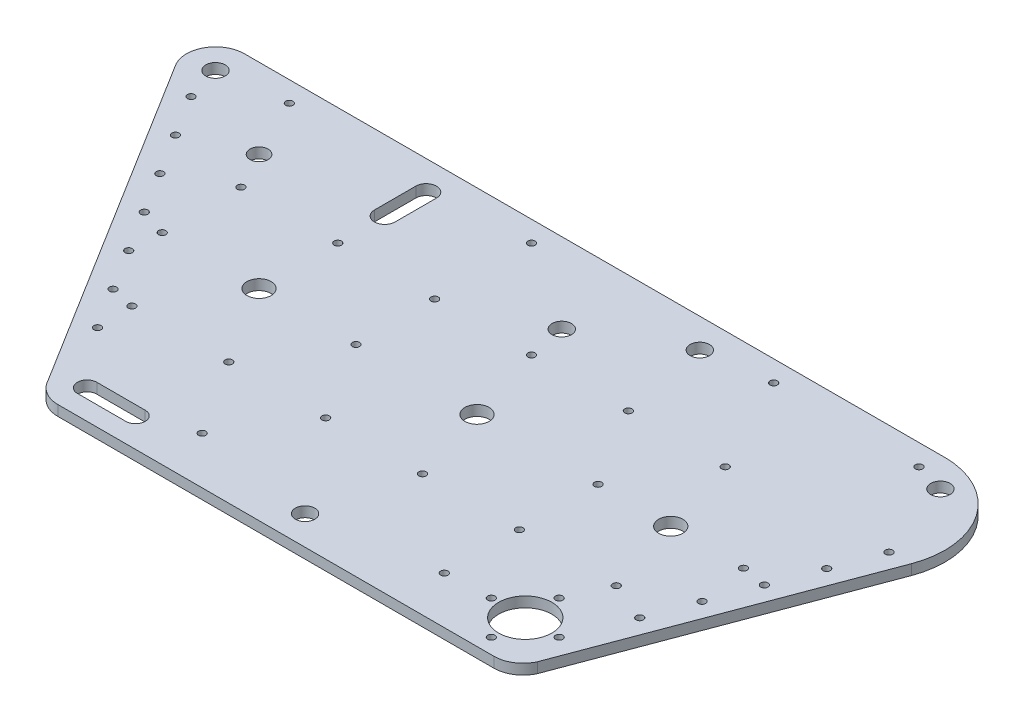
from build123d import *

# Parameters (mm, degrees)
BOSS_EXTRUDE1_DEPTH = 2


with BuildPart() as part:
    # Sketch1 → Boss-Extrude1 (new body)
    with BuildSketch(Plane(origin=(0, 0, 0), x_dir=(1, 0, 0), z_dir=(0, 1, 0))):
        with BuildLine():
            Line((85.656701038, 67.976827221), (-49.628186638, 67.857885829))
            add(Edge.make_bspline(
                [(-49.628186638, 67.857885829), (-59.775166253, 67.848964685), (-54.347438121, 59.275261117)],
                knots=[0.000879148, 0.000879148, 0.000879148, 2.135198153, 2.135198153, 2.135198153], degree=2, weights=[1, 0.482613975, 1]))
            Line((-54.347438121, 59.275261117), (-13.905478058, -5.817250798))
            add(Edge.make_bspline(
                [(-13.905478058, -5.817250798), (-12.345348453, -8.895182027), (-8.894737247, -8.895182019)],
                knots=[2.039949792, 2.039949792, 2.039949792, 3.141592656, 3.141592656, 3.141592656], degree=2, weights=[1, 0.852094883, 1]))
            Line((-8.894737247, -8.895182019), (75.37119476, -8.895182019))
            add(Edge.make_bspline(
                [(75.37119476, -8.895182019), (78.976029181, -8.895181965), (80.478043524, -5.618009696)],
                knots=[3.141592668, 3.141592668, 3.141592668, 4.282613549, 4.282613549, 4.282613549], degree=2, weights=[1, 0.841625416, 1]))
            Line((80.478043524, -5.618009696), (100.220157787, 46.97229785))
            add(Edge.make_bspline(
                [(100.220157787, 46.97229785), (108.112194499, 67.995610365), (85.657365109, 67.97682779)],
                knots=[4.353256006, 4.353256006, 4.353256006, 6.284014289, 6.284014289, 6.284014289], degree=2, weights=[1, 0.569095733, 0.999977608]))
            Line((85.657365109, 67.976827804), (85.656701038, 67.976827221))
        make_face()
        with BuildLine():
            add(Edge.make_bspline(
                [(-17.959803405, 8.507196014), (-19.176077367, 8.507196014), (-18.567940386, 7.453819196), (-17.959803405, 6.400442378), (-17.351666423, 7.453819196), (-16.743529442, 8.507196014), (-17.959803405, 8.507196014)],
                knots=[0, 0, 0, 2.094395102, 2.094395102, 4.188790205, 4.188790205, 6.283185307, 6.283185307, 6.283185307], degree=2, weights=[1, 0.5, 1, 0.5, 1, 0.5, 1]))
        make_face(mode=Mode.SUBTRACT)
        with BuildLine():
            add(Edge.make_bspline(
                [(-8.89473726, -1.404502424), (-10.767313525, -1.404502424), (-10.767313525, -3.277172323), (-10.767313525, -5.149842222), (-8.89473726, -5.149842222)],
                knots=[3.141592654, 3.141592654, 3.141592654, 4.71238898, 4.71238898, 6.283185307, 6.283185307, 6.283185307], degree=2, weights=[1, 0.707106781, 1, 0.707106781, 1]))
            Line((-8.89473726, -1.404502424), (0.468144066, -1.404502424))
            add(Edge.make_bspline(
                [(0.468144066, -5.149842222), (2.340720332, -5.149842222), (2.340720332, -3.277172323), (2.340720332, -1.404502424), (0.468144066, -1.404502424)],
                knots=[0, 0, 0, 1.570796327, 1.570796327, 3.141592654, 3.141592654, 3.141592654], degree=2, weights=[1, 0.707106781, 1, 0.707106781, 1]))
            Line((0.468144066, -5.149842222), (-8.89473726, -5.149842222))
        make_face(mode=Mode.SUBTRACT)
        with BuildLine():
            add(Edge.make_bspline(
                [(9.831025393, 0.936334949), (8.61475143, 0.936334949), (9.222888411, -0.117041869), (9.831025393, -1.170418687), (10.439162374, -0.117041869), (11.047299355, 0.936334949), (9.831025393, 0.936334949)],
                knots=[0, 0, 0, 2.094395102, 2.094395102, 4.188790205, 4.188790205, 6.283185307, 6.283185307, 6.283185307], degree=2, weights=[1, 0.5, 1, 0.5, 1, 0.5, 1]))
        make_face(mode=Mode.SUBTRACT)
        with BuildLine():
            add(Edge.make_bspline(
                [(-18.257618586, 14.045021577), (-17.041344624, 14.045021577), (-17.649481605, 15.098398395), (-18.257618586, 16.151775213), (-18.865755567, 15.098398395), (-19.473892548, 14.045021577), (-18.257618586, 14.045021577)],
                knots=[0, 0, 0, 2.094395102, 2.094395102, 4.188790205, 4.188790205, 6.283185307, 6.283185307, 6.283185307], degree=2, weights=[1, 0.5, 1, 0.5, 1, 0.5, 1]))
        make_face(mode=Mode.SUBTRACT)
        with BuildLine():
            add(Edge.make_bspline(
                [(-22.90100282, 15.055697878), (-21.684728858, 15.055697878), (-22.292865839, 16.109074696), (-22.90100282, 17.162451514), (-23.509139801, 16.109074696), (-24.117276782, 15.055697878), (-22.90100282, 15.055697878)],
                knots=[0, 0, 0, 2.094395102, 2.094395102, 4.188790205, 4.188790205, 6.283185307, 6.283185307, 6.283185307], degree=2, weights=[1, 0.5, 1, 0.5, 1, 0.5, 1]))
        make_face(mode=Mode.SUBTRACT)
        with BuildLine():
            add(Edge.make_bspline(
                [(-27.842276924, 24.413324804), (-29.058550886, 24.413324804), (-28.450413905, 23.359947986), (-27.842276924, 22.306571168), (-27.234139943, 23.359947986), (-26.626002962, 24.413324804), (-27.842276924, 24.413324804)],
                knots=[0, 0, 0, 2.094395102, 2.094395102, 4.188790205, 4.188790205, 6.283185307, 6.283185307, 6.283185307], degree=2, weights=[1, 0.5, 1, 0.5, 1, 0.5, 1]))
        make_face(mode=Mode.SUBTRACT)
        with BuildLine():
            add(Edge.make_bspline(
                [(0.468144066, 15.449523113), (-0.748129896, 15.449523113), (-0.139992915, 14.396146295), (0.468144066, 13.342769477), (1.076281047, 14.396146295), (1.684418028, 15.449523113), (0.468144066, 15.449523113)],
                knots=[0, 0, 0, 2.094395102, 2.094395102, 4.188790205, 4.188790205, 6.283185307, 6.283185307, 6.283185307], degree=2, weights=[1, 0.5, 1, 0.5, 1, 0.5, 1]))
        make_face(mode=Mode.SUBTRACT)
        with BuildLine():
            add(Edge.make_bspline(
                [(19.193906719, 14.045018914), (20.410180681, 14.045018914), (19.8020437, 15.098395732), (19.193906719, 16.15177255), (18.585769738, 15.098395732), (17.977632757, 14.045018914), (19.193906719, 14.045018914)],
                knots=[0, 0, 0, 2.094395102, 2.094395102, 4.188790205, 4.188790205, 6.283185307, 6.283185307, 6.283185307], degree=2, weights=[1, 0.5, 1, 0.5, 1, 0.5, 1]))
        make_face(mode=Mode.SUBTRACT)
        with BuildLine():
            add(Edge.make_bspline(
                [(33.238228708, -1.404502424), (29.994831476, -1.404502424), (31.616530092, -4.213507272), (33.238228708, -7.02251212), (34.859927324, -4.213507272), (36.481625941, -1.404502424), (33.238228708, -1.404502424)],
                knots=[0, 0, 0, 2.094395102, 2.094395102, 4.188790205, 4.188790205, 6.283185307, 6.283185307, 6.283185307], degree=2, weights=[1, 0.5, 1, 0.5, 1, 0.5, 1]))
        make_face(mode=Mode.SUBTRACT)
        with BuildLine():
            add(Edge.make_bspline(
                [(56.645432024, 0.936334949), (55.429158062, 0.936334949), (56.037295043, -0.117041869), (56.645432024, -1.170418687), (57.253569005, -0.117041869), (57.861705986, 0.936334949), (56.645432024, 0.936334949)],
                knots=[0, 0, 0, 2.094395102, 2.094395102, 4.188790205, 4.188790205, 6.283185307, 6.283185307, 6.283185307], degree=2, weights=[1, 0.5, 1, 0.5, 1, 0.5, 1]))
        make_face(mode=Mode.SUBTRACT)
        with BuildLine():
            add(Edge.make_bspline(
                [(65.376638006, 1.295412091), (64.160364044, 1.295412091), (64.768501025, 0.242035273), (65.376638006, -0.811341545), (65.984774987, 0.242035273), (66.592911968, 1.295412091), (65.376638006, 1.295412091)],
                knots=[0, 0, 0, 2.094395102, 2.094395102, 4.188790205, 4.188790205, 6.283185307, 6.283185307, 6.283185307], degree=2, weights=[1, 0.5, 1, 0.5, 1, 0.5, 1]))
        make_face(mode=Mode.SUBTRACT)
        with BuildLine():
            add(Edge.make_bspline(
                [(71.930654934, -6.663434979), (73.146928897, -6.663434979), (72.538791915, -5.610058161), (71.930654934, -4.556681343), (71.322517953, -5.610058161), (70.714380972, -6.663434979), (71.930654934, -6.663434979)],
                knots=[0, 0, 0, 2.094395102, 2.094395102, 4.188790205, 4.188790205, 6.283185307, 6.283185307, 6.283185307], degree=2, weights=[1, 0.5, 1, 0.5, 1, 0.5, 1]))
        make_face(mode=Mode.SUBTRACT)
        with BuildLine():
            add(Edge.make_bspline(
                [(71.930654934, 5.7430031), (63.011312545, 5.7430031), (67.47098374, -1.981760232), (71.930654934, -9.706523564), (76.390326129, -1.981760232), (80.849997324, 5.7430031), (71.930654934, 5.7430031)],
                knots=[0, 0, 0, 2.094395102, 2.094395102, 4.188790205, 4.188790205, 6.283185307, 6.283185307, 6.283185307], degree=2, weights=[1, 0.5, 1, 0.5, 1, 0.5, 1]))
        make_face(mode=Mode.SUBTRACT)
        with BuildLine():
            add(Edge.make_bspline(
                [(78.484671863, 1.295412091), (77.268397901, 1.295412091), (77.876534882, 0.242035273), (78.484671863, -0.811341545), (79.092808844, 0.242035273), (79.700945825, 1.295412091), (78.484671863, 1.295412091)],
                knots=[0, 0, 0, 2.094395102, 2.094395102, 4.188790205, 4.188790205, 6.283185307, 6.283185307, 6.283185307], degree=2, weights=[1, 0.5, 1, 0.5, 1, 0.5, 1]))
        make_face(mode=Mode.SUBTRACT)
        with BuildLine():
            add(Edge.make_bspline(
                [(71.930654934, 7.849756737), (70.714380972, 7.849756737), (71.322517953, 6.796379918), (71.930654934, 5.7430031), (72.538791915, 6.796379918), (73.146928897, 7.849756737), (71.930654934, 7.849756737)],
                knots=[0, 0, 0, 2.094395102, 2.094395102, 4.188790205, 4.188790205, 6.283185307, 6.283185307, 6.283185307], degree=2, weights=[1, 0.5, 1, 0.5, 1, 0.5, 1]))
        make_face(mode=Mode.SUBTRACT)
        with BuildLine():
            add(Edge.make_bspline(
                [(37.919669371, 14.045017582), (39.135943333, 14.045017582), (38.527806352, 15.0983944), (37.919669371, 16.151771218), (37.31153239, 15.0983944), (36.703395409, 14.045017582), (37.919669371, 14.045017582)],
                knots=[0, 0, 0, 2.094395102, 2.094395102, 4.188790205, 4.188790205, 6.283185307, 6.283185307, 6.283185307], degree=2, weights=[1, 0.5, 1, 0.5, 1, 0.5, 1]))
        make_face(mode=Mode.SUBTRACT)
        with BuildLine():
            add(Edge.make_bspline(
                [(56.645432024, 15.449517787), (55.429158062, 15.449517787), (56.037295043, 14.396140969), (56.645432024, 13.342764151), (57.253569005, 14.396140969), (57.861705986, 15.449517787), (56.645432024, 15.449517787)],
                knots=[0, 0, 0, 2.094395102, 2.094395102, 4.188790205, 4.188790205, 6.283185307, 6.283185307, 6.283185307], degree=2, weights=[1, 0.5, 1, 0.5, 1, 0.5, 1]))
        make_face(mode=Mode.SUBTRACT)
        with BuildLine():
            add(Edge.make_bspline(
                [(75.371194676, 15.449516455), (74.154920714, 15.449516455), (74.763057695, 14.396139637), (75.371194676, 13.342762819), (75.979331657, 14.396139637), (76.587468638, 15.449516455), (75.371194676, 15.449516455)],
                knots=[0, 0, 0, 2.094395102, 2.094395102, 4.188790205, 4.188790205, 6.283185307, 6.283185307, 6.283185307], degree=2, weights=[1, 0.5, 1, 0.5, 1, 0.5, 1]))
        make_face(mode=Mode.SUBTRACT)
        with BuildLine():
            add(Edge.make_bspline(
                [(83.020453054, 12.338299391), (81.804179092, 12.338299391), (82.412316073, 11.284922573), (83.020453054, 10.231545755), (83.628590035, 11.284922573), (84.236727016, 12.338299391), (83.020453054, 12.338299391)],
                knots=[0, 0, 0, 2.094395102, 2.094395102, 4.188790205, 4.188790205, 6.283185307, 6.283185307, 6.283185307], degree=2, weights=[1, 0.5, 1, 0.5, 1, 0.5, 1]))
        make_face(mode=Mode.SUBTRACT)
        with BuildLine():
            add(Edge.make_bspline(
                [(86.296635223, 19.704982002), (87.512909186, 19.704982002), (86.904772205, 20.75835882), (86.296635223, 21.811735639), (85.688498242, 20.75835882), (85.080361261, 19.704982002), (86.296635223, 19.704982002)],
                knots=[0, 0, 0, 2.094395102, 2.094395102, 4.188790205, 4.188790205, 6.283185307, 6.283185307, 6.283185307], degree=2, weights=[1, 0.5, 1, 0.5, 1, 0.5, 1]))
        make_face(mode=Mode.SUBTRACT)
        with BuildLine():
            add(Edge.make_bspline(
                [(89.572829219, 28.4761987), (90.789103181, 28.4761987), (90.1809662, 29.529575518), (89.572829219, 30.582952336), (88.964692238, 29.529575518), (88.356555257, 28.4761987), (89.572829219, 28.4761987)],
                knots=[0, 0, 0, 2.094395102, 2.094395102, 4.188790205, 4.188790205, 6.283185307, 6.283185307, 6.283185307], degree=2, weights=[1, 0.5, 1, 0.5, 1, 0.5, 1]))
        make_face(mode=Mode.SUBTRACT)
        with BuildLine():
            add(Edge.make_bspline(
                [(-32.783649251, 32.366607399), (-33.999923213, 32.366607399), (-33.391786232, 31.313230581), (-32.783649251, 30.259853763), (-32.17551227, 31.313230581), (-31.567375289, 32.366607399), (-32.783649251, 32.366607399)],
                knots=[0, 0, 0, 2.094395102, 2.094395102, 4.188790205, 4.188790205, 6.283185307, 6.283185307, 6.283185307], degree=2, weights=[1, 0.5, 1, 0.5, 1, 0.5, 1]))
        make_face(mode=Mode.SUBTRACT)
        with BuildLine():
            add(Edge.make_bspline(
                [(-27.620499912, 30.664969592), (-28.836773875, 30.664969592), (-28.228636893, 29.611592774), (-27.620499912, 28.558215956), (-27.012362931, 29.611592774), (-26.40422595, 30.664969592), (-27.620499912, 30.664969592)],
                knots=[0, 0, 0, 2.094395102, 2.094395102, 4.188790205, 4.188790205, 6.283185307, 6.283185307, 6.283185307], degree=2, weights=[1, 0.5, 1, 0.5, 1, 0.5, 1]))
        make_face(mode=Mode.SUBTRACT)
        with BuildLine():
            add(Edge.make_bspline(
                [(-42.666304897, 48.273029328), (-43.882578859, 48.273029328), (-43.274441878, 47.21965251), (-42.666304897, 46.166275692), (-42.058167916, 47.21965251), (-41.450030935, 48.273029328), (-42.666304897, 48.273029328)],
                knots=[0, 0, 0, 2.094395102, 2.094395102, 4.188790205, 4.188790205, 6.283185307, 6.283185307, 6.283185307], degree=2, weights=[1, 0.5, 1, 0.5, 1, 0.5, 1]))
        make_face(mode=Mode.SUBTRACT)
        with BuildLine():
            add(Edge.make_bspline(
                [(-37.725067646, 38.915461719), (-36.508793684, 38.915461719), (-37.116930665, 39.968838537), (-37.725067646, 41.022215355), (-38.333204628, 39.968838537), (-38.941341609, 38.915461719), (-37.725067646, 38.915461719)],
                knots=[0, 0, 0, 2.094395102, 2.094395102, 4.188790205, 4.188790205, 6.283185307, 6.283185307, 6.283185307], degree=2, weights=[1, 0.5, 1, 0.5, 1, 0.5, 1]))
        make_face(mode=Mode.SUBTRACT)
        with BuildLine():
            add(Edge.make_bspline(
                [(-27.620499912, 45.880412519), (-28.836773875, 45.880412519), (-28.228636893, 44.827035701), (-27.620499912, 43.773658883), (-27.012362931, 44.827035701), (-26.40422595, 45.880412519), (-27.620499912, 45.880412519)],
                knots=[0, 0, 0, 2.094395102, 2.094395102, 4.188790205, 4.188790205, 6.283185307, 6.283185307, 6.283185307], degree=2, weights=[1, 0.5, 1, 0.5, 1, 0.5, 1]))
        make_face(mode=Mode.SUBTRACT)
        with BuildLine():
            add(Edge.make_bspline(
                [(-8.89473726, 27.621881006), (-4.840490719, 27.621881006), (-6.86761399, 31.133137067), (-8.89473726, 34.644393127), (-10.92186053, 31.133137067), (-12.9489838, 27.621881006), (-8.89473726, 27.621881006)],
                knots=[0, 0, 0, 2.094395102, 2.094395102, 4.188790205, 4.188790205, 6.283185307, 6.283185307, 6.283185307], degree=2, weights=[1, 0.5, 1, 0.5, 1, 0.5, 1]))
        make_face(mode=Mode.SUBTRACT)
        with BuildLine():
            add(Edge.make_bspline(
                [(9.831025393, 30.664969592), (8.61475143, 30.664969592), (9.222888411, 29.611592774), (9.831025393, 28.558215956), (10.439162374, 29.611592774), (11.047299355, 30.664969592), (9.831025393, 30.664969592)],
                knots=[0, 0, 0, 2.094395102, 2.094395102, 4.188790205, 4.188790205, 6.283185307, 6.283185307, 6.283185307], degree=2, weights=[1, 0.5, 1, 0.5, 1, 0.5, 1]))
        make_face(mode=Mode.SUBTRACT)
        with BuildLine():
            add(Edge.make_bspline(
                [(-8.89473726, 45.880412519), (-10.111011222, 45.880412519), (-9.502874241, 44.827035701), (-8.89473726, 43.773658883), (-8.286600279, 44.827035701), (-7.678463298, 45.880412519), (-8.89473726, 45.880412519)],
                knots=[0, 0, 0, 2.094395102, 2.094395102, 4.188790205, 4.188790205, 6.283185307, 6.283185307, 6.283185307], degree=2, weights=[1, 0.5, 1, 0.5, 1, 0.5, 1]))
        make_face(mode=Mode.SUBTRACT)
        with BuildLine():
            add(Edge.make_bspline(
                [(9.831025393, 45.880412519), (8.61475143, 45.880412519), (9.222888411, 44.827035701), (9.831025393, 43.773658883), (10.439162374, 44.827035701), (11.047299355, 45.880412519), (9.831025393, 45.880412519)],
                knots=[0, 0, 0, 2.094395102, 2.094395102, 4.188790205, 4.188790205, 6.283185307, 6.283185307, 6.283185307], degree=2, weights=[1, 0.5, 1, 0.5, 1, 0.5, 1]))
        make_face(mode=Mode.SUBTRACT)
        with BuildLine():
            add(Edge.make_bspline(
                [(-47.607580181, 54.821653305), (-46.391306219, 54.821653305), (-46.9994432, 55.875030123), (-47.607580181, 56.928406941), (-48.215717162, 55.875030123), (-48.823854143, 54.821653305), (-47.607580181, 54.821653305)],
                knots=[0, 0, 0, 2.094395102, 2.094395102, 4.188790205, 4.188790205, 6.283185307, 6.283185307, 6.283185307], degree=2, weights=[1, 0.5, 1, 0.5, 1, 0.5, 1]))
        make_face(mode=Mode.SUBTRACT)
        with BuildLine():
            add(Edge.make_bspline(
                [(-31.365652443, 54.190385195), (-34.406337348, 54.190385195), (-32.885994896, 51.55694315), (-31.365652443, 48.923501105), (-29.84530999, 51.55694315), (-28.324967537, 54.190385195), (-31.365652443, 54.190385195)],
                knots=[0, 0, 0, 2.094395102, 2.094395102, 4.188790205, 4.188790205, 6.283185307, 6.283185307, 6.283185307], degree=2, weights=[1, 0.5, 1, 0.5, 1, 0.5, 1]))
        make_face(mode=Mode.SUBTRACT)
        with BuildLine():
            add(Edge.make_bspline(
                [(-49.623271029, 64.138944032), (-52.866668261, 64.138944032), (-51.244969645, 61.329939184), (-49.623271029, 58.520934336), (-48.001572413, 61.329939184), (-46.379873797, 64.138944032), (-49.623271029, 64.138944032)],
                knots=[0, 0, 0, 2.094395102, 2.094395102, 4.188790205, 4.188790205, 6.283185307, 6.283185307, 6.283185307], degree=2, weights=[1, 0.5, 1, 0.5, 1, 0.5, 1]))
        make_face(mode=Mode.SUBTRACT)
        with BuildLine():
            add(Edge.make_bspline(
                [(-36.983376619, 64.607111507), (-38.199650581, 64.607111507), (-37.5915136, 63.553734689), (-36.983376619, 62.50035787), (-36.375239638, 63.553734689), (-35.767102657, 64.607111507), (-36.983376619, 64.607111507)],
                knots=[0, 0, 0, 2.094395102, 2.094395102, 4.188790205, 4.188790205, 6.283185307, 6.283185307, 6.283185307], degree=2, weights=[1, 0.5, 1, 0.5, 1, 0.5, 1]))
        make_face(mode=Mode.SUBTRACT)
        with BuildLine():
            Line((-10.89473726, 54.266274133), (-10.89473726, 62.266274133))
            ThreePointArc((-10.89473726, 62.266274133), (-8.89473726, 64.266274133), (-6.89473726, 62.266274133))
            Line((-6.89473726, 62.266274133), (-6.89473726, 54.266274133))
            ThreePointArc((-6.89473726, 54.266274133), (-8.89473726, 52.266274133), (-10.89473726, 54.266274133))
        make_face(mode=Mode.SUBTRACT)
        with BuildLine():
            add(Edge.make_bspline(
                [(9.831025393, 64.607111507), (8.61475143, 64.607111507), (9.222888411, 63.553734689), (9.831025393, 62.50035787), (10.439162374, 63.553734689), (11.047299355, 64.607111507), (9.831025393, 64.607111507)],
                knots=[0, 0, 0, 2.094395102, 2.094395102, 4.188790205, 4.188790205, 6.283185307, 6.283185307, 6.283185307], degree=2, weights=[1, 0.5, 1, 0.5, 1, 0.5, 1]))
        make_face(mode=Mode.SUBTRACT)
        with BuildLine():
            add(Edge.make_bspline(
                [(33.238228708, 27.621881006), (37.292475249, 27.621881006), (35.265351978, 31.133137067), (33.238228708, 34.644393127), (31.211105438, 31.133137067), (29.183982168, 27.621881006), (33.238228708, 27.621881006)],
                knots=[0, 0, 0, 2.094395102, 2.094395102, 4.188790205, 4.188790205, 6.283185307, 6.283185307, 6.283185307], degree=2, weights=[1, 0.5, 1, 0.5, 1, 0.5, 1]))
        make_face(mode=Mode.SUBTRACT)
        with BuildLine():
            add(Edge.make_bspline(
                [(56.645432024, 30.664969592), (55.429158062, 30.664969592), (56.037295043, 29.611592774), (56.645432024, 28.558215956), (57.253569005, 29.611592774), (57.861705986, 30.664969592), (56.645432024, 30.664969592)],
                knots=[0, 0, 0, 2.094395102, 2.094395102, 4.188790205, 4.188790205, 6.283185307, 6.283185307, 6.283185307], degree=2, weights=[1, 0.5, 1, 0.5, 1, 0.5, 1]))
        make_face(mode=Mode.SUBTRACT)
        with BuildLine():
            add(Edge.make_bspline(
                [(28.556788045, 45.880412519), (27.340514083, 45.880412519), (27.948651064, 44.827035701), (28.556788045, 43.773658883), (29.164925026, 44.827035701), (29.773062007, 45.880412519), (28.556788045, 45.880412519)],
                knots=[0, 0, 0, 2.094395102, 2.094395102, 4.188790205, 4.188790205, 6.283185307, 6.283185307, 6.283185307], degree=2, weights=[1, 0.5, 1, 0.5, 1, 0.5, 1]))
        make_face(mode=Mode.SUBTRACT)
        with BuildLine():
            add(Edge.make_bspline(
                [(47.282550697, 45.880412519), (46.066276735, 45.880412519), (46.674413716, 44.827035701), (47.282550697, 43.773658883), (47.890687679, 44.827035701), (48.49882466, 45.880412519), (47.282550697, 45.880412519)],
                knots=[0, 0, 0, 2.094395102, 2.094395102, 4.188790205, 4.188790205, 6.283185307, 6.283185307, 6.283185307], degree=2, weights=[1, 0.5, 1, 0.5, 1, 0.5, 1]))
        make_face(mode=Mode.SUBTRACT)
        with BuildLine():
            add(Edge.make_bspline(
                [(66.00831335, 45.880412519), (64.792039388, 45.880412519), (65.400176369, 44.827035701), (66.00831335, 43.773658883), (66.616450331, 44.827035701), (67.224587312, 45.880412519), (66.00831335, 45.880412519)],
                knots=[0, 0, 0, 2.094395102, 2.094395102, 4.188790205, 4.188790205, 6.283185307, 6.283185307, 6.283185307], degree=2, weights=[1, 0.5, 1, 0.5, 1, 0.5, 1]))
        make_face(mode=Mode.SUBTRACT)
        with BuildLine():
            add(Edge.make_bspline(
                [(70.689754013, 27.621881006), (74.744000554, 27.621881006), (72.716877283, 31.133137067), (70.689754013, 34.644393127), (68.662630743, 31.133137067), (66.635507472, 27.621881006), (70.689754013, 27.621881006)],
                knots=[0, 0, 0, 2.094395102, 2.094395102, 4.188790205, 4.188790205, 6.283185307, 6.283185307, 6.283185307], degree=2, weights=[1, 0.5, 1, 0.5, 1, 0.5, 1]))
        make_face(mode=Mode.SUBTRACT)
        with BuildLine():
            add(Edge.make_bspline(
                [(84.734076002, 30.664969592), (83.51780204, 30.664969592), (84.125939021, 29.611592774), (84.734076002, 28.558215956), (85.342212983, 29.611592774), (85.950349965, 30.664969592), (84.734076002, 30.664969592)],
                knots=[0, 0, 0, 2.094395102, 2.094395102, 4.188790205, 4.188790205, 6.283185307, 6.283185307, 6.283185307], degree=2, weights=[1, 0.5, 1, 0.5, 1, 0.5, 1]))
        make_face(mode=Mode.SUBTRACT)
        with BuildLine():
            add(Edge.make_bspline(
                [(92.849052932, 38.651997381), (91.632778969, 38.651997381), (92.240915951, 37.598620563), (92.849052932, 36.545243745), (93.457189913, 37.598620563), (94.065326894, 38.651997381), (92.849052932, 38.651997381)],
                knots=[0, 0, 0, 2.094395102, 2.094395102, 4.188790205, 4.188790205, 6.283185307, 6.283185307, 6.283185307], degree=2, weights=[1, 0.5, 1, 0.5, 1, 0.5, 1]))
        make_face(mode=Mode.SUBTRACT)
        with BuildLine():
            add(Edge.make_bspline(
                [(96.125307483, 46.018873777), (97.341581445, 46.018873777), (96.733444464, 47.072250595), (96.125307483, 48.125627413), (95.517170502, 47.072250595), (94.909033521, 46.018873777), (96.125307483, 46.018873777)],
                knots=[0, 0, 0, 2.094395102, 2.094395102, 4.188790205, 4.188790205, 6.283185307, 6.283185307, 6.283185307], degree=2, weights=[1, 0.5, 1, 0.5, 1, 0.5, 1]))
        make_face(mode=Mode.SUBTRACT)
        with BuildLine():
            add(Edge.make_bspline(
                [(27.152355846, 54.307427063), (23.908958614, 54.307427063), (25.53065723, 51.498422215), (27.152355846, 48.689417367), (28.774054462, 51.498422215), (30.395753079, 54.307427063), (27.152355846, 54.307427063)],
                knots=[0, 0, 0, 2.094395102, 2.094395102, 4.188790205, 4.188790205, 6.283185307, 6.283185307, 6.283185307], degree=2, weights=[1, 0.5, 1, 0.5, 1, 0.5, 1]))
        make_face(mode=Mode.SUBTRACT)
        with BuildLine():
            add(Edge.make_bspline(
                [(44.005505159, 64.138944032), (40.762107926, 64.138944032), (42.383806542, 61.329939184), (44.005505159, 58.520934336), (45.627203775, 61.329939184), (47.248902391, 64.138944032), (44.005505159, 64.138944032)],
                knots=[0, 0, 0, 2.094395102, 2.094395102, 4.188790205, 4.188790205, 6.283185307, 6.283185307, 6.283185307], degree=2, weights=[1, 0.5, 1, 0.5, 1, 0.5, 1]))
        make_face(mode=Mode.SUBTRACT)
        with BuildLine():
            add(Edge.make_bspline(
                [(56.645432024, 64.607111507), (55.429158062, 64.607111507), (56.037295043, 63.553734689), (56.645432024, 62.50035787), (57.253569005, 63.553734689), (57.861705986, 64.607111507), (56.645432024, 64.607111507)],
                knots=[0, 0, 0, 2.094395102, 2.094395102, 4.188790205, 4.188790205, 6.283185307, 6.283185307, 6.283185307], degree=2, weights=[1, 0.5, 1, 0.5, 1, 0.5, 1]))
        make_face(mode=Mode.SUBTRACT)
        with BuildLine():
            add(Edge.make_bspline(
                [(84.734076002, 64.607111507), (83.51780204, 64.607111507), (84.125939021, 63.553734689), (84.734076002, 62.50035787), (85.342212983, 63.553734689), (85.950349965, 64.607111507), (84.734076002, 64.607111507)],
                knots=[0, 0, 0, 2.094395102, 2.094395102, 4.188790205, 4.188790205, 6.283185307, 6.283185307, 6.283185307], degree=2, weights=[1, 0.5, 1, 0.5, 1, 0.5, 1]))
        make_face(mode=Mode.SUBTRACT)
        with BuildLine():
            add(Edge.make_bspline(
                [(90.510811212, 64.138944032), (87.26741398, 64.138944032), (88.889112596, 61.329939184), (90.510811212, 58.520934336), (92.132509829, 61.329939184), (93.754208445, 64.138944032), (90.510811212, 64.138944032)],
                knots=[0, 0, 0, 2.094395102, 2.094395102, 4.188790205, 4.188790205, 6.283185307, 6.283185307, 6.283185307], degree=2, weights=[1, 0.5, 1, 0.5, 1, 0.5, 1]))
        make_face(mode=Mode.SUBTRACT)
    extrude(amount=BOSS_EXTRUDE1_DEPTH)


solid = part.part
